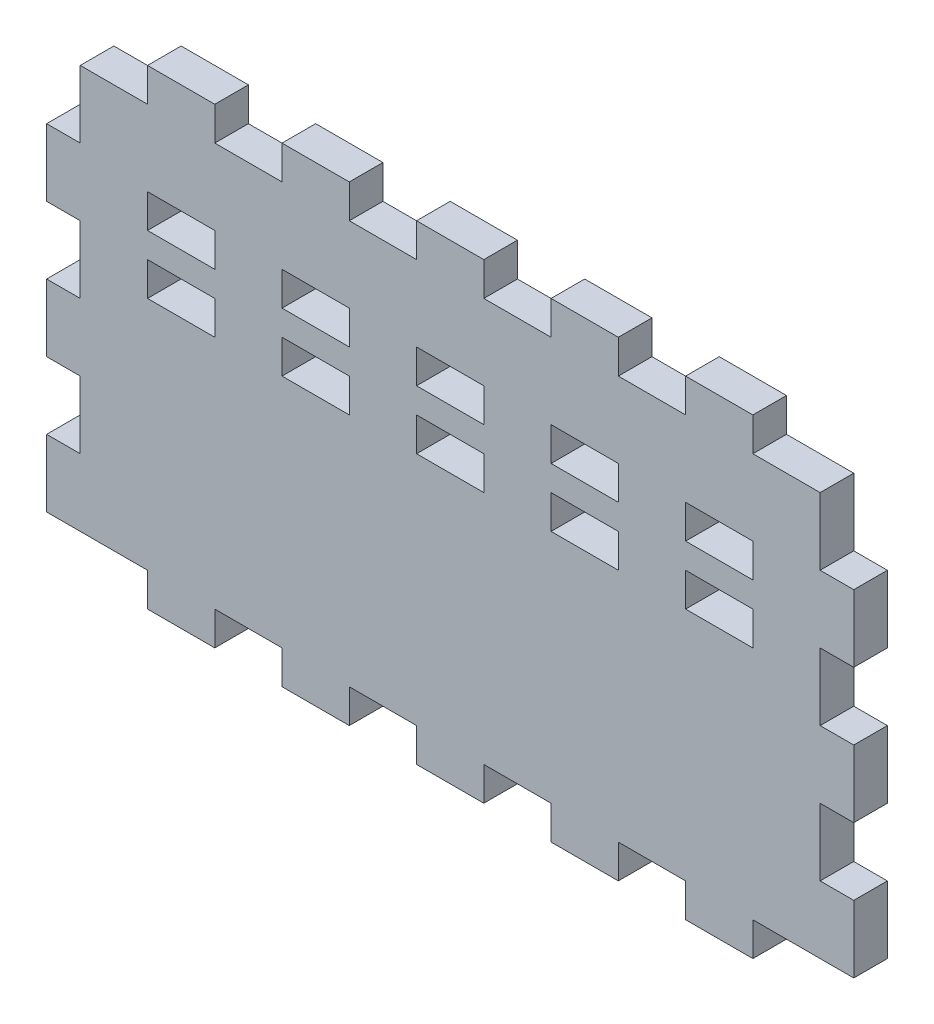
from build123d import *

# Parameters (mm, degrees)
SKETCH1_W               = 279.4
SKETCH1_H               = 152.4
BOSS_EXTRUDE1_DEPTH     = 12.7
SKETCH2_W               = 25.4
SKETCH2_H               = 12.7
BOSS_EXTRUDE2_DEPTH     = 12.7
LPATTERN1_COUNT         = 5
LPATTERN1_PITCH         = 50.8
MIRROR1_COPY_1_SKETCH_W = 25.4
MIRROR1_COPY_1_SKETCH_H = 12.7
MIRROR1_COPY_1_DEPTH    = 12.7
MIRROR1_COPY_2_SKETCH_W = 25.4
MIRROR1_COPY_2_SKETCH_H = 12.7
MIRROR1_COPY_2_DEPTH    = 12.7
MIRROR1_COPY_3_SKETCH_W = 25.4
MIRROR1_COPY_3_SKETCH_H = 12.7
MIRROR1_COPY_3_DEPTH    = 12.7
MIRROR1_COPY_4_SKETCH_W = 25.4
MIRROR1_COPY_4_SKETCH_H = 12.7
MIRROR1_COPY_4_DEPTH    = 12.7
MIRROR1_COPY_5_SKETCH_W = 25.4
MIRROR1_COPY_5_SKETCH_H = 12.7
MIRROR1_COPY_5_DEPTH    = 12.7
SKETCH3_W               = 12.7
SKETCH3_H               = 25.4
BOSS_EXTRUDE3_DEPTH     = 12.7
LPATTERN2_COUNT         = 3
LPATTERN2_PITCH         = 50.8
MIRROR2_COPY_1_SKETCH_W = 12.7
MIRROR2_COPY_1_SKETCH_H = 25.4
MIRROR2_COPY_1_DEPTH    = 12.7
MIRROR2_COPY_2_SKETCH_W = 12.7
MIRROR2_COPY_2_SKETCH_H = 25.4
MIRROR2_COPY_2_DEPTH    = 12.7
MIRROR2_COPY_3_SKETCH_W = 12.7
MIRROR2_COPY_3_SKETCH_H = 25.4
MIRROR2_COPY_3_DEPTH    = 12.7
SKETCH4_W               = 25.4
SKETCH4_H               = 12.7
CUT_EXTRUDE1_DEPTH      = 177.89053112
LPATTERN3_COUNT         = 5
LPATTERN3_PITCH         = 50.8


with BuildPart() as part:
    # Sketch1 → Boss-Extrude1 (new body)
    with BuildSketch(Plane.XY):
        Rectangle(SKETCH1_W, SKETCH1_H)
    extrude(amount=BOSS_EXTRUDE1_DEPTH)

    # Sketch2 → Boss-Extrude2 (add)
    with BuildSketch(Plane.XZ.offset(76.2)):
        with Locations((-101.6, 6.35)):
            Rectangle(SKETCH2_W, SKETCH2_H)
    boss_extrude2 = extrude(amount=BOSS_EXTRUDE2_DEPTH)

    # LPattern1: Boss-Extrude2 ×5
    with Locations(*[(i * LPATTERN1_PITCH, 0, 0) for i in range(1, LPATTERN1_COUNT)]):
        add(boss_extrude2)

    # Mirror1 copy 1 sketch → Mirror1 copy 1 (add)
    with BuildSketch(Plane(origin=(50.8, 76.2, 0), x_dir=(1, 0, 0), z_dir=(0, 1, 0))):
        with Locations((-101.6, -6.35)):
            Rectangle(MIRROR1_COPY_1_SKETCH_W, MIRROR1_COPY_1_SKETCH_H)
    extrude(amount=MIRROR1_COPY_1_DEPTH)

    # Mirror1 copy 2 sketch → Mirror1 copy 2 (add)
    with BuildSketch(Plane(origin=(101.6, 76.2, 0), x_dir=(1, 0, 0), z_dir=(0, 1, 0))):
        with Locations((-101.6, -6.35)):
            Rectangle(MIRROR1_COPY_2_SKETCH_W, MIRROR1_COPY_2_SKETCH_H)
    extrude(amount=MIRROR1_COPY_2_DEPTH)

    # Mirror1 copy 3 sketch → Mirror1 copy 3 (add)
    with BuildSketch(Plane(origin=(152.4, 76.2, 0), x_dir=(1, 0, 0), z_dir=(0, 1, 0))):
        with Locations((-101.6, -6.35)):
            Rectangle(MIRROR1_COPY_3_SKETCH_W, MIRROR1_COPY_3_SKETCH_H)
    extrude(amount=MIRROR1_COPY_3_DEPTH)

    # Mirror1 copy 4 sketch → Mirror1 copy 4 (add)
    with BuildSketch(Plane(origin=(203.2, 76.2, 0), x_dir=(1, 0, 0), z_dir=(0, 1, 0))):
        with Locations((-101.6, -6.35)):
            Rectangle(MIRROR1_COPY_4_SKETCH_W, MIRROR1_COPY_4_SKETCH_H)
    extrude(amount=MIRROR1_COPY_4_DEPTH)

    # Mirror1 copy 5 sketch → Mirror1 copy 5 (add)
    with BuildSketch(Plane(origin=(0, 76.2, 0), x_dir=(1, 0, 0), z_dir=(0, 1, 0))):
        with Locations((-101.6, -6.35)):
            Rectangle(MIRROR1_COPY_5_SKETCH_W, MIRROR1_COPY_5_SKETCH_H)
    extrude(amount=MIRROR1_COPY_5_DEPTH)

    # Sketch3 → Boss-Extrude3 (add)
    with BuildSketch(Plane(origin=(139.7, 0, 0), x_dir=(0, 0, -1), z_dir=(1, 0, 0))):
        with Locations((-6.35, -63.5)):
            Rectangle(SKETCH3_W, SKETCH3_H)
    boss_extrude3 = extrude(amount=BOSS_EXTRUDE3_DEPTH)

    # LPattern2: Boss-Extrude3 ×3
    with Locations(*[(0, i * LPATTERN2_PITCH, 0) for i in range(1, LPATTERN2_COUNT)]):
        add(boss_extrude3)

    # Mirror2 copy 1 sketch → Mirror2 copy 1 (add)
    with BuildSketch(Plane(origin=(-139.7, 50.8, 0), x_dir=(0, 0, -1), z_dir=(-1, 0, 0))):
        with Locations((-6.35, 63.5)):
            Rectangle(MIRROR2_COPY_1_SKETCH_W, MIRROR2_COPY_1_SKETCH_H)
    extrude(amount=MIRROR2_COPY_1_DEPTH)

    # Mirror2 copy 2 sketch → Mirror2 copy 2 (add)
    with BuildSketch(Plane(origin=(-139.7, 101.6, 0), x_dir=(0, 0, -1), z_dir=(-1, 0, 0))):
        with Locations((-6.35, 63.5)):
            Rectangle(MIRROR2_COPY_2_SKETCH_W, MIRROR2_COPY_2_SKETCH_H)
    extrude(amount=MIRROR2_COPY_2_DEPTH)

    # Mirror2 copy 3 sketch → Mirror2 copy 3 (add)
    with BuildSketch(Plane(origin=(-139.7, 0, 0), x_dir=(0, 0, -1), z_dir=(-1, 0, 0))):
        with Locations((-6.35, 63.5)):
            Rectangle(MIRROR2_COPY_3_SKETCH_W, MIRROR2_COPY_3_SKETCH_H)
    extrude(amount=MIRROR2_COPY_3_DEPTH)

    # Sketch4 → Cut-Extrude1 (cut, through all)
    with BuildSketch(Plane.XY.offset(12.7)):
        with Locations((-101.6, 19.05)):
            Rectangle(SKETCH4_W, SKETCH4_H)
        with Locations((-101.6, 41.275)):
            Rectangle(SKETCH4_W, SKETCH4_H)
    cut_extrude1 = extrude(amount=-CUT_EXTRUDE1_DEPTH, mode=Mode.SUBTRACT)

    # LPattern3: Cut-Extrude1 ×5
    with Locations(*[(i * LPATTERN3_PITCH, 0, 0) for i in range(1, LPATTERN3_COUNT)]):
        add(cut_extrude1, mode=Mode.SUBTRACT)


solid = part.part
